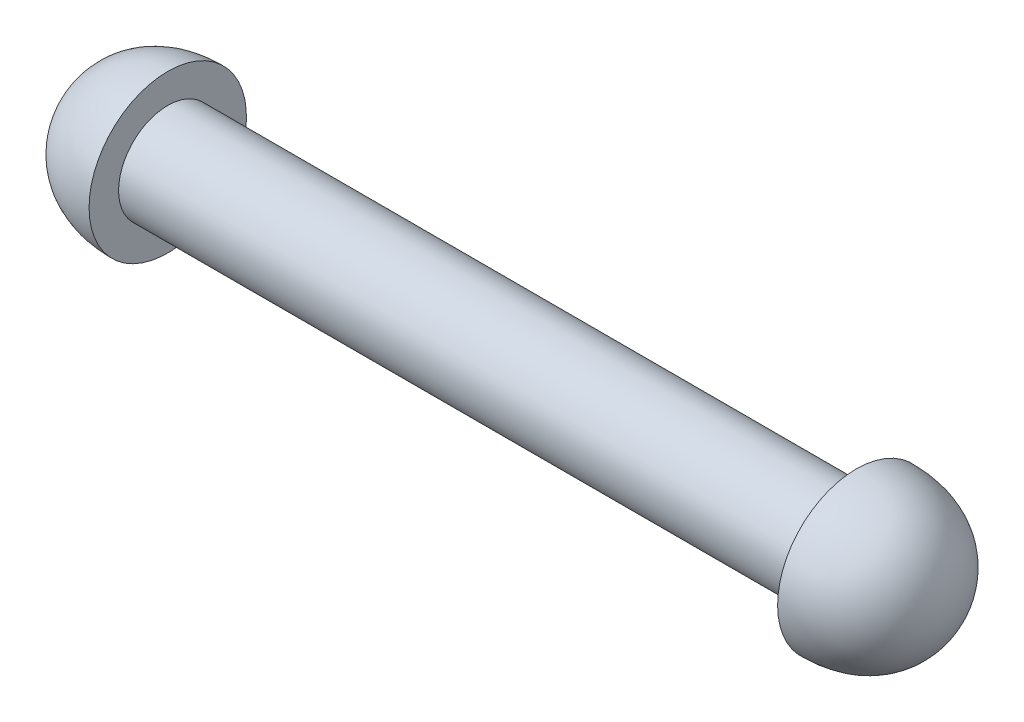
from build123d import *

# Parameters (mm, degrees)
SKETCH1_R           = 25
BOSS_EXTRUDE1_DEPTH = 175


with BuildPart() as part:
    # Sketch1 → Boss-Extrude1 (new body)
    with BuildSketch(Plane(origin=(0, 0, 0), x_dir=(0, 0, -1), z_dir=(1, 0, 0))):
        Circle(SKETCH1_R)
    boss_extrude1 = extrude(amount=BOSS_EXTRUDE1_DEPTH)

    # Sketch3 → Revolve1 (revolve)
    with BuildSketch(Plane.XY):
        with BuildLine():
            Line((0, 0), (-45.458392513, 0))
            add(Edge.make_bspline(
                [(-45.458392513, 0), (-45.458392513, 20.183781855), (-30.991238831, 40), (0, 40)],
                knots=[0, 0, 0, 0, 1, 1, 1, 1], degree=3))
            Line((0, 40), (0, 0))
        make_face()
    revolve1 = revolve(axis=Axis((-100.078673334, 0, 0), (1, 0, 0)))

    # Mirror1: Boss-Extrude1, Revolve1 across plane
    add(boss_extrude1.mirror(Plane(origin=(175, 0, 0), x_dir=(0, 0, 1), z_dir=(1, 0, 0))))
    add(revolve1.mirror(Plane(origin=(175, 0, 0), x_dir=(0, 0, 1), z_dir=(1, 0, 0))))


solid = part.part
